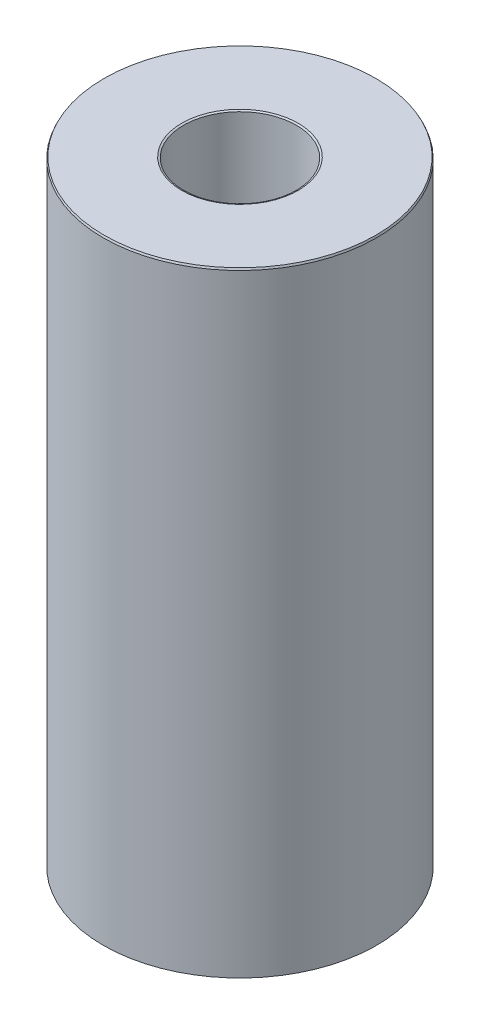
from build123d import *
from OCP.BRepFilletAPI import BRepFilletAPI_MakeChamfer

# Parameters (mm, degrees)
SKETCH1_R           = 50
BOSS_EXTRUDE1_DEPTH = 225.124120595
SKETCH2_R           = 20.636535868
CUT_EXTRUDE1_DEPTH  = 236.967942047
CHAMFER1_SIZE       = 0.667811321
CHAMFER1_SIZE2      = 0.297295181


with BuildPart() as part:
    # Sketch1 → Boss-Extrude1 (new body)
    with BuildSketch(Plane(origin=(0, 0, 0), x_dir=(1, 0, 0), z_dir=(0, 1, 0))):
        Circle(SKETCH1_R)
    extrude(amount=BOSS_EXTRUDE1_DEPTH)

    # Sketch2 → Cut-Extrude1 (cut, through all)
    with BuildSketch(Plane(origin=(0, 0, 0), x_dir=(1, 0, 0), z_dir=(0, 1, 0))):
        Circle(SKETCH2_R)
    extrude(amount=CUT_EXTRUDE1_DEPTH, mode=Mode.SUBTRACT)

    # Chamfer1: one chamfer whose edges measure the first distance from different faces: ONE call of the kernel's chamfer builder (chamfer() names one face for all edges)
    chamfer1_edges_1 = [part.edges().sort_by_distance(p)[0] for p in [
        (-20.636535868, 225.124120595, 0),
    ]]
    chamfer1_side_1 = [part.faces().sort_by_distance(p)[0] for p in [
        (-48.585786438, 225.124120595, 0),
    ]]
    chamfer1_edges_2 = [part.edges().sort_by_distance(p)[0] for p in [
        (-20.636535868, 0, 0),
    ]]
    chamfer1_side_2 = [part.faces().sort_by_distance(p)[0] for p in [
        (-20.636535868, 112.562060298, 0),
    ]]
    chamfer1_edges_3 = [part.edges().sort_by_distance(p)[0] for p in [
        (-50, 0, 0),
    ]]
    chamfer1_side_3 = [part.faces().sort_by_distance(p)[0] for p in [
        (-48.585786438, 0, 0),
    ]]
    chamfer1_edges_4 = [part.edges().sort_by_distance(p)[0] for p in [
        (-50, 225.124120595, 0),
    ]]
    chamfer1_side_4 = [part.faces().sort_by_distance(p)[0] for p in [
        (-50, 112.562060298, 0),
    ]]
    chamfer1 = BRepFilletAPI_MakeChamfer(part.part.solid().wrapped)
    for e in chamfer1_edges_1:
        chamfer1.Add(CHAMFER1_SIZE, CHAMFER1_SIZE2, e.wrapped, chamfer1_side_1[0].wrapped)  # the first distance lies on this face
    for e in chamfer1_edges_2:
        chamfer1.Add(CHAMFER1_SIZE, CHAMFER1_SIZE2, e.wrapped, chamfer1_side_2[0].wrapped)  # the first distance lies on this face
    for e in chamfer1_edges_3:
        chamfer1.Add(CHAMFER1_SIZE, CHAMFER1_SIZE2, e.wrapped, chamfer1_side_3[0].wrapped)  # the first distance lies on this face
    for e in chamfer1_edges_4:
        chamfer1.Add(CHAMFER1_SIZE, CHAMFER1_SIZE2, e.wrapped, chamfer1_side_4[0].wrapped)  # the first distance lies on this face
    add(Compound.cast(chamfer1.Shape()), mode=Mode.REPLACE)


solid = part.part
